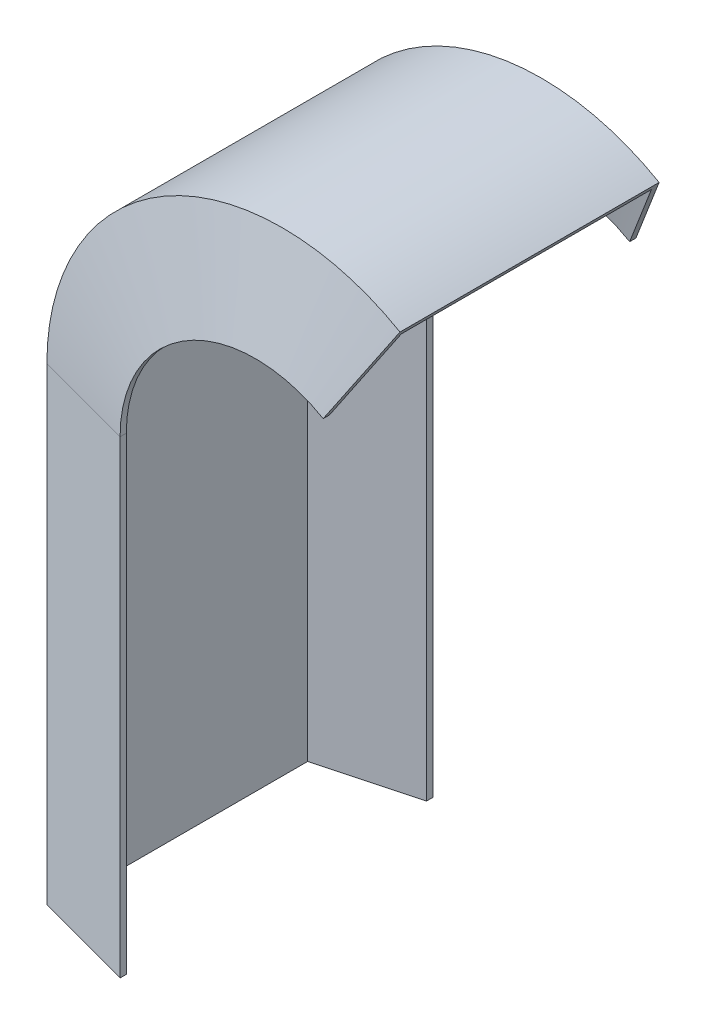
from build123d import *


with BuildPart() as part:
    # Sweep2: sweep along a path in Sketch1
    with BuildLine(Plane.XY) as sweep2_path:
        Line((0, 0), (0, 150))
        ThreePointArc((0, 150), (36.666666667, 213.508529611), (110, 213.508529611))
    # Sketch2 → Sweep2 (sweep)
    with BuildSketch(Plane(origin=(0, 0, 0), x_dir=(1, 0, 0), z_dir=(0, 1, 0))):
        Polygon((0, 40), (0, -40), (30, -48.038475773), (30, -50.038475773), (-2, -41.464101615), (-2, 41.464101615), (30, 50.038475773), (30, 48.038475773), align=None)
    sweep(path=sweep2_path.line)


solid = part.part
